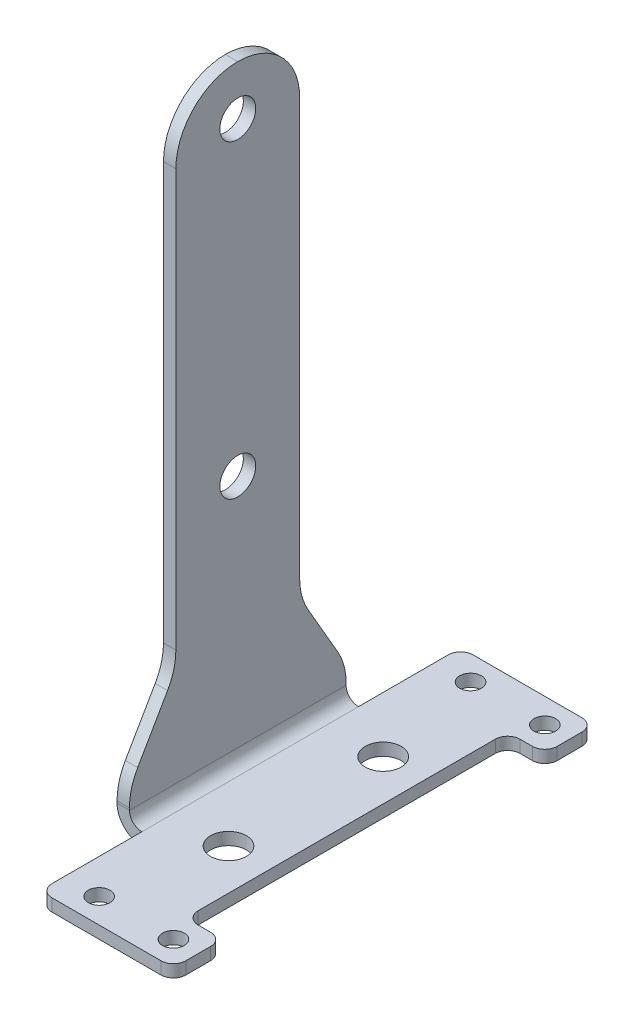
from build123d import *

# Parameters (mm, degrees)
BASE_FLANGE1_DEPTH   = 17.5
M5_CLEARANCE_HOLE2_D = 5.8
M5_CLEARANCE_HOLE1_D = 5.8
CUT_EXTRUDE3_DEPTH   = 2
SKETCH21_R           = 1.75
BOSS_EXTRUDE1_DEPTH  = 2
SKETCH22_W           = 6
SKETCH22_H           = 52
CUT_EXTRUDE4_DEPTH   = 10
FILLET1_R            = 2
FILLET2_R            = 10


# Sheet-metal steps are written as plain solids
with BuildPart() as part:
    # Sketch1 → Base-Flange1 (new, symmetric)
    with BuildSketch(Plane.XY):
        with BuildLine():
            Line((0, 100), (0, 4))
            ThreePointArc((0, 4), (1.171572875, 1.171572875), (4, 0))
            Line((4, 0), (19, 0))
            Line((19, 0), (19, 2))
            Line((19, 2), (4, 2))
            ThreePointArc((4, 2), (2.585786438, 2.585786438), (2, 4))
            Line((2, 4), (2, 100))
            Line((2, 100), (0, 100))
        make_face()
    extrude(amount=BASE_FLANGE1_DEPTH, both=True)

    # M5 Clearance Hole2 (through all)
    with Locations(Plane(origin=(0, 2, 0), x_dir=(1, 0, 0), z_dir=(0, 1, 0))):
        with Locations((13, -12.5), (13, 12.5)):
            Hole(M5_CLEARANCE_HOLE2_D / 2)

    # M5 Clearance Hole1 (through all)
    with Locations(Plane(origin=(2, 0, 0), x_dir=(0, 0, -1), z_dir=(1, 0, 0))):
        with Locations((0, 92), (0, 42)):
            Hole(M5_CLEARANCE_HOLE1_D / 2)

    # Sketch20 → Cut-Extrude3 (cut)
    with BuildSketch(Plane(origin=(2, 0, 0), x_dir=(0, 0, -1), z_dir=(1, 0, 0))):
        Polygon((-10, 100), (-10, 19.990381057), (-17.5, 7), (-17.5, 100), align=None)
    cut_extrude3 = extrude(amount=-CUT_EXTRUDE3_DEPTH, mode=Mode.SUBTRACT)

    # Mirror1: Cut-Extrude3 across plane
    add(cut_extrude3.mirror(Plane.XY), mode=Mode.SUBTRACT)

    # Sketch21 → Boss-Extrude1 (add)
    with BuildSketch(Plane(origin=(0, 2, 0), x_dir=(1, 0, 0), z_dir=(0, 1, 0))):
        Polygon((4, -17.5), (19, -17.5), (19, 0), (25.6, 0), (25.6, -17.5), (25.6, -34), (4, -34), align=None)
        with Locations(Location((9.6, -30, 0), (0, 0, 270))):
            Circle(SKETCH21_R, mode=Mode.SUBTRACT)
        with Locations(Location((21.6, -30, 0), (0, 0, 270))):
            Circle(SKETCH21_R, mode=Mode.SUBTRACT)
    boss_extrude1 = extrude(amount=-BOSS_EXTRUDE1_DEPTH)

    # Mirror2: Boss-Extrude1 across plane
    add(boss_extrude1.mirror(Plane.XY))

    # Sketch22 → Cut-Extrude4 (cut)
    with BuildSketch(Plane(origin=(0, 2, 0), x_dir=(1, 0, 0), z_dir=(0, 1, 0))):
        with Locations((22.6, 0)):
            Rectangle(SKETCH22_W, SKETCH22_H)
    extrude(amount=-CUT_EXTRUDE4_DEPTH, mode=Mode.SUBTRACT)

    # Fillet1
    fillet1_edges = [part.edges().sort_by_distance(p)[0] for p in [
        (4, 1, 34),
        (25.6, 1, 34),
        (4, 1, -34),
        (25.6, 1, -34),
        (25.6, 1, -26),
        (25.6, 1, 26),
        (19.6, 1, 26),
        (19.6, 1, -26),
    ]]
    fillet(fillet1_edges, radius=FILLET1_R)

    # Fillet2
    fillet2_edges = [part.edges().sort_by_distance(p)[0] for p in [
        (1, 7, 17.5),
        (1, 7, -17.5),
        (1, 19.990381057, 10),
        (1, 19.990381057, -10),
        (1, 100, 10),
        (1, 100, -10),
    ]]
    fillet(fillet2_edges, radius=FILLET2_R - 0.0001)  # a hair under: the kernel refuses the full size


solid = part.part
